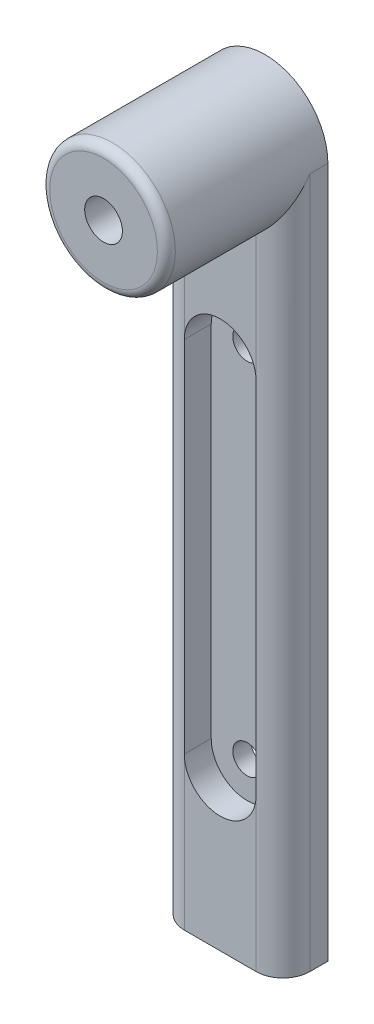
from build123d import *

# Parameters (mm, degrees)
SKETCH1_R           = 7
BOSS_EXTRUDE1_DEPTH = 18
SKETCH2_W           = 14
SKETCH2_H           = 77
BOSS_EXTRUDE2_DEPTH = 5
SKETCH8_R           = 2.1
CUT_EXTRUDE5_DEPTH  = 18
FILLET3_R           = 3
CUT_EXTRUDE6_DEPTH  = 3
SKETCH10_R          = 1.6
CUT_EXTRUDE7_DEPTH  = 3
FILLET4_R           = 1


with BuildPart() as part:
    # Sketch1 → Boss-Extrude1 (new body)
    with BuildSketch(Plane.XY):
        Circle(SKETCH1_R)
    extrude(amount=BOSS_EXTRUDE1_DEPTH)

    # Sketch2 → Boss-Extrude2 (add)
    with BuildSketch(Plane.XY):
        with Locations((0, -38.5)):
            Rectangle(SKETCH2_W, SKETCH2_H)
    extrude(amount=BOSS_EXTRUDE2_DEPTH)

    # Sketch8 → Cut-Extrude5 (cut)
    with BuildSketch(Plane.XY.offset(18)):
        Circle(SKETCH8_R)
    extrude(amount=-CUT_EXTRUDE5_DEPTH, mode=Mode.SUBTRACT)

    # Fillet3
    # the kernel refuses this fillet: 3 mm, written as the material it takes off along each edge
    with BuildSketch(Plane(origin=(7, 7.5, 5), x_dir=(-1, 0, 0), z_dir=(0, -1, 0))) as fillet3_piece_1_section:
        with BuildLine():
            CenterArc((FILLET3_R, FILLET3_R), FILLET3_R, 180, 90)
            Line((0, FILLET3_R), (0, 0))
            Line((0, 0), (FILLET3_R, 0))
        make_face()
    fillet3_piece_1 = extrude(amount=92, mode=Mode.PRIVATE)
    fillet3_piece_1 = fillet3_piece_1 - Plane(origin=(0, 0, 4.306838987), x_dir=(1, 0, 0), z_dir=(0, 0, -1)) * Cylinder(7, 196, mode=Mode.PRIVATE)
    add(fillet3_piece_1, mode=Mode.SUBTRACT)
    with BuildSketch(Plane(origin=(-7, -84.5, 5), x_dir=(0, 0, -1), z_dir=(0, 1, 0))) as fillet3_piece_2_section:
        with BuildLine():
            CenterArc((FILLET3_R, -FILLET3_R), FILLET3_R, 90, 90)
            Line((0, -FILLET3_R), (0, 0))
            Line((0, 0), (FILLET3_R, 0))
        make_face()
    fillet3_piece_2 = extrude(amount=92, mode=Mode.PRIVATE)
    fillet3_piece_2 = fillet3_piece_2 - Plane(origin=(0, 0, 4.306838506), x_dir=(1, 0, 0), z_dir=(0, 0, -1)) * Cylinder(7, 196, mode=Mode.PRIVATE)
    add(fillet3_piece_2, mode=Mode.SUBTRACT)

    # Sketch6 → Cut-Extrude6 (cut)
    with BuildSketch(Plane.XY.offset(5)):
        with BuildLine():
            Line((4, -20), (4, -60))
            ThreePointArc((4, -60), (0, -64), (-4, -60))
            Line((-4, -60), (-4, -20))
            ThreePointArc((-4, -20), (0, -16), (4, -20))
        make_face()
    extrude(amount=-CUT_EXTRUDE6_DEPTH, mode=Mode.SUBTRACT)

    # Sketch10 → Cut-Extrude7 (cut)
    with BuildSketch(Plane.XY.offset(2)):
        with Locations((0, -20)):
            Circle(SKETCH10_R)
        with Locations((0, -60)):
            Circle(SKETCH10_R)
    extrude(amount=-CUT_EXTRUDE7_DEPTH, mode=Mode.SUBTRACT)

    # Fillet4
    fillet4_edges = [part.edges().sort_by_distance(p)[0] for p in [
        (-7, 0, 18),
    ]]
    fillet(fillet4_edges, radius=FILLET4_R)


solid = part.part
